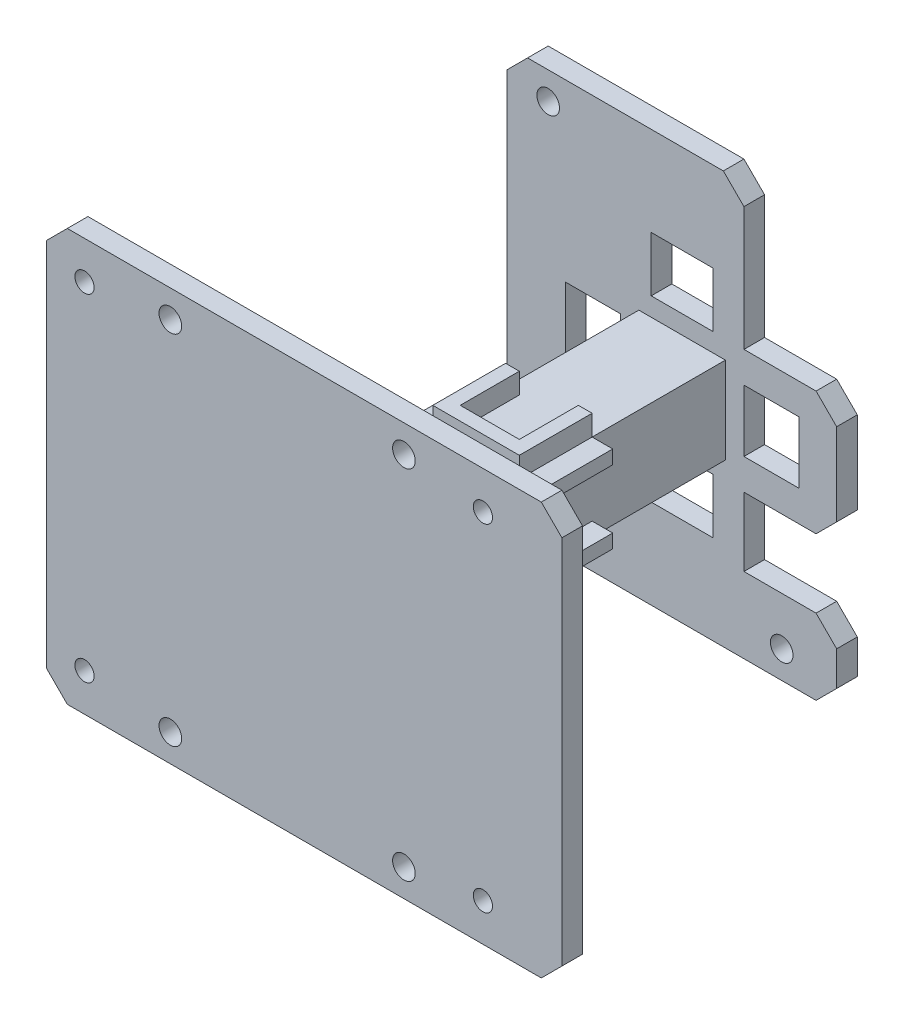
from build123d import *

# Parameters (mm, degrees)
SKETCH_4_R          = 1.65
SKETCH_4_R_2        = 1.4
EXTRUDE_1_DEPTH     = 3
EXTRUDE_2_DEPTH     = 30
SKETCH_6_W          = 9
SKETCH_6_H          = 8
SKETCH_6_W_2        = 8
SKETCH_6_H_2        = 9
CUT_EXTRUDE_2_DEPTH = 62.951594007
EXTRUDE_3_DEPTH     = 3
EXTRUDE_4_DEPTH     = 3
EXTRUDE_5_DEPTH     = 3
EXTRUDE_6_DEPTH     = 3
SKETCH_13_W         = 12.6
SKETCH_13_H         = 12.6
EXTRUDE_7_DEPTH     = 22
SKETCH_14_R         = 1.4
SKETCH_14_R_2       = 1.65
EXTRUDE_8_DEPTH     = 3
SKETCH_15_W         = 13.5
SKETCH_15_H         = 21
SKETCH_15_H_2       = 10
CUT_EXTRUDE_3_DEPTH = 84.366660003
CHAMFER_1_SIZE      = 3
CUT_EXTRUDE_4_DEPTH = 10
CHAMFER_2_SIZE      = 3


with BuildPart() as part:
    # 草图4 → 凸台-拉伸1 (new body)
    with BuildSketch(Plane.XY):
        Polygon((5, 19), (5, 30), (-39, 30), (-43, 30), (-43, -30), (-39, -30), (20, -30), (20, -19), (5, -19), align=None)
        with Locations((-3, 26)):
            Circle(SKETCH_4_R, mode=Mode.SUBTRACT)
        with Locations((-37, 26)):
            Circle(SKETCH_4_R, mode=Mode.SUBTRACT)
        with Locations((-37, -26)):
            Circle(SKETCH_4_R, mode=Mode.SUBTRACT)
        with Locations((-3, -26)):
            Circle(SKETCH_4_R, mode=Mode.SUBTRACT)
        with Locations((8.5, -24.5)):
            Circle(SKETCH_4_R_2, mode=Mode.SUBTRACT)
    extrude(amount=EXTRUDE_1_DEPTH)

    # 草图5 → 凸台-拉伸2 (add)
    with BuildSketch(Plane.XY.offset(3)):
        Polygon((-22.855, 6.3), (-23.8, 6.3), (-23.8, -6.3), (-12.145, -6.3), (-11.2, -6.3), (-11.2, 6.3), (-13.96, 6.3), align=None)
    extrude(amount=EXTRUDE_2_DEPTH)

    # 草图6 → 切除-拉伸2 (cut, through all)
    with BuildSketch(Plane(origin=(0, 0, 0), x_dir=(-1, 0, 0), z_dir=(0, 0, -1))):
        with Locations((17.5, 13)):
            Rectangle(SKETCH_6_W, SKETCH_6_H)
        with Locations((30.5, 0)):
            Rectangle(SKETCH_6_W_2, SKETCH_6_H_2)
        with Locations((17.5, -13)):
            Rectangle(SKETCH_6_W, SKETCH_6_H)
        with Locations((4.5, 0)):
            Rectangle(SKETCH_6_W_2, SKETCH_6_H_2)
    extrude(amount=-CUT_EXTRUDE_2_DEPTH, mode=Mode.SUBTRACT)

    # 草图8 → 凸台-拉伸3 (add)
    with BuildSketch(Plane(origin=(-11.2, 0, 0), x_dir=(0, 0, -1), z_dir=(1, 0, 0))):
        Polygon((-31, 4.3), (-22.4, 4.3), (-22.4, 6.3), (-33, 6.3), (-33, -6.3), (-22.4, -6.3), (-22.4, -4.3), (-31, -4.3), align=None)
    extrude(amount=EXTRUDE_3_DEPTH)

    # 草图10 → 凸台-拉伸4 (add)
    with BuildSketch(Plane.ZY.offset(23.8)):
        Polygon((22.4, 6.3), (22.4, 4.3), (31, 4.3), (31, -4.3), (22.4, -4.3), (22.4, -6.3), (33, -6.3), (33, 6.3), align=None)
    extrude(amount=EXTRUDE_4_DEPTH)

    # 草图11 → 凸台-拉伸5 (add)
    with BuildSketch(Plane.XZ.offset(6.3)):
        Polygon((-23.8, 22.4), (-23.8, 33), (-11.2, 33), (-11.2, 22.4), (-13.2, 22.4), (-13.2, 31), (-21.8, 31), (-21.8, 22.4), align=None)
    extrude(amount=EXTRUDE_5_DEPTH)

    # 草图12 → 凸台-拉伸6 (add)
    with BuildSketch(Plane(origin=(0, 6.3, 0), x_dir=(1, 0, 0), z_dir=(0, 1, 0))):
        Polygon((-23.8, -22.4), (-23.8, -33), (-11.2, -33), (-11.2, -22.4), (-13.2, -22.4), (-13.2, -31), (-21.8, -31), (-21.8, -22.4), align=None)
    extrude(amount=EXTRUDE_6_DEPTH)

    # 草图13 → 凸台-拉伸7 (add)
    with BuildSketch(Plane.XY.offset(33)):
        with Locations((-17.5, 0)):
            Rectangle(SKETCH_13_W, SKETCH_13_H)
    extrude(amount=EXTRUDE_7_DEPTH)

    # 草图14 → 凸台-拉伸8 (add)
    with BuildSketch(Plane.XY.offset(55)):
        Polygon((-39, 30), (20, 30), (20, -30), (-39, -30), (-55, -30), (-55, 30), align=None)
        with Locations((-49.5, 24.5)):
            Circle(SKETCH_14_R, mode=Mode.SUBTRACT)
        with Locations((8.5, 24.5)):
            Circle(SKETCH_14_R, mode=Mode.SUBTRACT)
        with Locations((-3, 26)):
            Circle(SKETCH_14_R_2, mode=Mode.SUBTRACT)
        with Locations((-37, 26)):
            Circle(SKETCH_14_R_2, mode=Mode.SUBTRACT)
        with Locations((-37, -26)):
            Circle(SKETCH_14_R_2, mode=Mode.SUBTRACT)
        with Locations((-3, -26)):
            Circle(SKETCH_14_R_2, mode=Mode.SUBTRACT)
        with Locations((8.5, -24.5)):
            Circle(SKETCH_14_R, mode=Mode.SUBTRACT)
        with Locations((-49.5, -24.5)):
            Circle(SKETCH_14_R, mode=Mode.SUBTRACT)
    extrude(amount=EXTRUDE_8_DEPTH)

    # 草图15 → 切除-拉伸3 (cut, through all)
    with BuildSketch(Plane.XY.offset(3)):
        with Locations((-1.75, 19.5)):
            Rectangle(SKETCH_15_W, SKETCH_15_H)
        with Locations((-1.75, -14)):
            Rectangle(SKETCH_15_W, SKETCH_15_H_2)
    extrude(amount=-CUT_EXTRUDE_3_DEPTH, mode=Mode.SUBTRACT)

    # 倒角1
    chamfer_1_edges = [part.edges().sort_by_distance(p)[0] for p in [
        (-43, -30, 1.5),
        (20, -30, 1.5),
        (20, -19, 1.5),
        (5, -9, 1.5),
        (5, 9, 1.5),
        (-43, 30, 1.5),
        (-8.5, 30, 1.5),
        (-55, 30, 56.5),
        (20, 30, 56.5),
        (20, -30, 56.5),
        (-55, -30, 56.5),
    ]]
    chamfer(chamfer_1_edges, length=CHAMFER_1_SIZE)

    # 草图16 → 切除-拉伸4 (cut)
    with BuildSketch(Plane.XY.offset(3)):
        Polygon((5, -19), (5, -30), (17, -30), (20, -27), (20, -22), (17, -19), align=None)
    extrude(amount=-CUT_EXTRUDE_4_DEPTH, mode=Mode.SUBTRACT)

    # 倒角2
    chamfer_2_edges = [part.edges().sort_by_distance(p)[0] for p in [
        (5, -19, 1.5),
        (5, -30, 1.5),
    ]]
    chamfer(chamfer_2_edges, length=CHAMFER_2_SIZE)


solid = part.part
